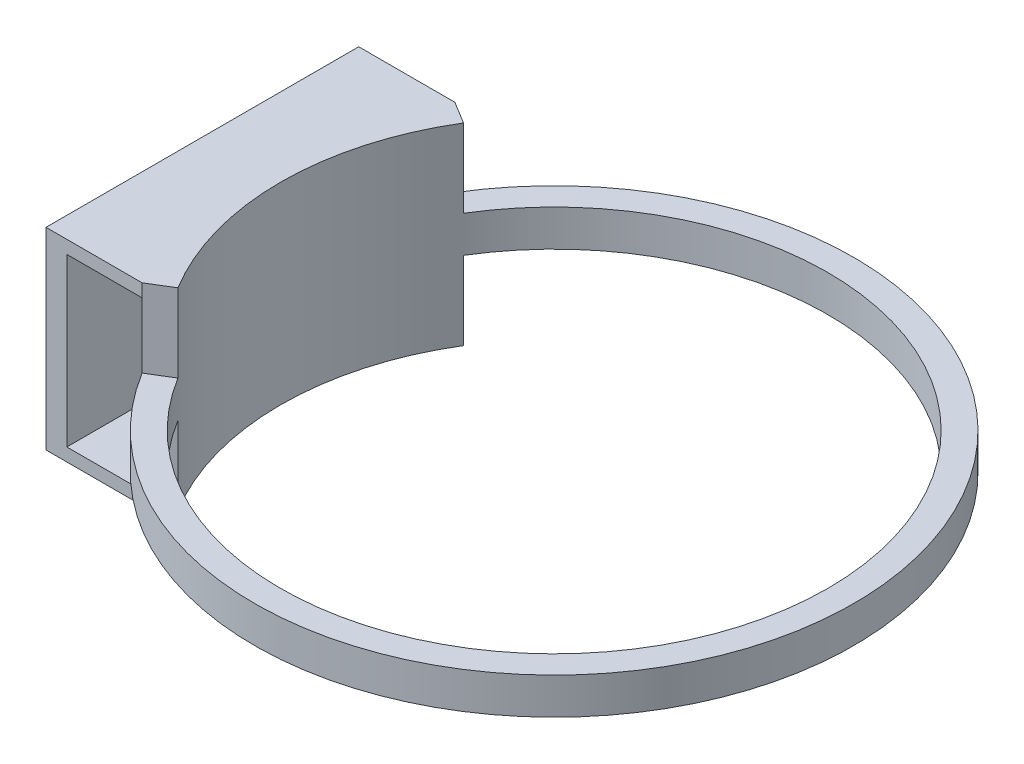
from build123d import *
from build123d.topology import SkipClean

# Parameters (mm, degrees)
EXTRUDE_1_DEPTH     = 0.5
EXTRUDE_2_DEPTH     = 6.4
EXTRUDE_3_DEPTH     = 0.5
EXTRUDE_START       = -7.4
EXTRUDE_6_DEPTH     = 7.4
SKETCH_16_W         = 0.8
SKETCH_16_H         = 12
EXTRUDE_10_DEPTH    = 6.4
EXTRUDE_11_DEPTH    = 0.5
CUT_EXTRUDE_START   = -3
CUT_EXTRUDE_1_DEPTH = 3
CUT_EXTRUDE_2_DEPTH = 3


# Read off the part's stored shape, not the designer's step: 凸台-拉伸2
with BuildPart() as part:
    # 草图1 → 凸台-拉伸1 (new body)
    with BuildSketch(Plane(origin=(0, 0, 0), x_dir=(1, 0, 0), z_dir=(0, 1, 0))):
        with BuildLine():
            Line((11.456239028, 1.002291042), (10.46004433, 0.915135299))
            ThreePointArc((10.46004433, 0.915135299), (-10.5, 0), (10.46004433, -0.915135299))
            Line((10.46004433, -0.915135299), (11.456239028, -1.002291042))
            ThreePointArc((11.456239028, -1.002291042), (5.310109052, -10.200624582), (-5.75, -9.959292144))
            ThreePointArc((-5.75, -9.959292144), (-8.028256991, -8.233898814), (-9.810708435, -6))
            Line((-9.810708435, -6), (-13.5, -6))
            Line((-13.5, -6), (-13.5, 0))
            Line((-13.5, 0), (-13.5, 6))
            Line((-13.5, 6), (-9.810708435, 6))
            ThreePointArc((-9.810708435, 6), (-8.028256991, 8.233898814), (-5.75, 9.959292144))
            ThreePointArc((-5.75, 9.959292144), (5.310109052, 10.200624582), (11.456239028, 1.002291042))
        make_face()
    extrude(amount=EXTRUDE_1_DEPTH)

    # 凸台-拉伸2 outline → 凸台-拉伸2 (add)
    with BuildSketch(Plane(origin=(0, 0.5, 0), x_dir=(1, 0, 0), z_dir=(0, 1, 0))):
        with BuildLine():
            ThreePointArc((11.456239028, 1.002291042), (-11.5, 0), (11.456239028, -1.002291042))
            Line((11.456239028, -1.002291042), (10.46004433, -0.915135299))
            ThreePointArc((10.46004433, -0.915135299), (-10.5, 0), (10.46004433, 0.915135299))
            Line((10.46004433, 0.915135299), (11.456239028, 1.002291042))
        make_face()
    extrude(amount=EXTRUDE_2_DEPTH)

    # 草图11 → 凸台-拉伸3 (add)
    with BuildSketch(Plane(origin=(0, 6.9, 0), x_dir=(1, 0, 0), z_dir=(0, 1, 0))):
        with BuildLine():
            Line((10.46004433, 0.915135299), (11.456239028, 1.002291042))
            ThreePointArc((11.456239028, 1.002291042), (-11.5, 0), (11.456239028, -1.002291042))
            Line((11.456239028, -1.002291042), (10.46004433, -0.915135299))
            ThreePointArc((10.46004433, -0.915135299), (-10.5, 0), (10.46004433, 0.915135299))
        make_face()
    extrude(amount=EXTRUDE_3_DEPTH)

    # 草图14 → 凸台-拉伸6 (add)
    with SkipClean():  # the faces are left unmerged after this step: merging them gives an invalid solid
        with BuildSketch(Plane(origin=(0, 7.4, 0), x_dir=(1, 0, 0), z_dir=(0, 1, 0)).offset(EXTRUDE_START)):
            with BuildLine():
                Line((10.46004433, 0.915135299), (11.456239028, 1.002291042))
                ThreePointArc((11.456239028, 1.002291042), (11.5, 0), (11.456239028, -1.002291042))
                Line((11.456239028, -1.002291042), (10.46004433, -0.915135299))
                ThreePointArc((10.46004433, -0.915135299), (10.5, 0), (10.46004433, 0.915135299))
            make_face()
        extrude(amount=EXTRUDE_6_DEPTH)
    add(part.part.scale(1), mode=Mode.REPLACE)  # the faces are merged on a copy

    # 草图16 → 凸台-拉伸10 (add)
    with BuildSketch(Plane(origin=(0, 0.5, 0), x_dir=(1, 0, 0), z_dir=(0, 1, 0))):
        with Locations((-13.1, 0)):
            Rectangle(SKETCH_16_W, SKETCH_16_H)
    extrude(amount=EXTRUDE_10_DEPTH)

    # 草图17 → 凸台-拉伸11 (add)
    with BuildSketch(Plane(origin=(0, 6.9, 0), x_dir=(1, 0, 0), z_dir=(0, 1, 0))):
        with BuildLine():
            Line((-13.5, 6), (-9.810708435, 6))
            ThreePointArc((-9.810708435, 6), (-11.5, 0), (-9.810708435, -6))
            Line((-9.810708435, -6), (-13.5, -6))
            Line((-13.5, -6), (-13.5, 6))
        make_face()
    extrude(amount=EXTRUDE_11_DEPTH)

    # 草图18 → 切除-拉伸1 (cut)
    with BuildSketch(Plane(origin=(0, 7.4, 0), x_dir=(1, 0, 0), z_dir=(0, 1, 0)).offset(CUT_EXTRUDE_START)):
        with BuildLine():
            Line((-9.810708435, 6), (-8.957603354, 5.47826087))
            ThreePointArc((-8.957603354, 5.47826087), (10.5, 0), (-8.957603354, -5.47826087))
            Line((-8.957603354, -5.47826087), (-9.810708435, -6))
            ThreePointArc((-9.810708435, -6), (11.5, 0), (-9.810708435, 6))
        make_face()
    extrude(amount=CUT_EXTRUDE_1_DEPTH, mode=Mode.SUBTRACT)

    # 草图19 → 切除-拉伸2 (cut)
    with BuildSketch(Plane(origin=(0, 0, 0), x_dir=(-1, 0, 0), z_dir=(0, -1, 0))):
        with BuildLine():
            Line((9.810708435, 6), (8.957603354, 5.47826087))
            ThreePointArc((8.957603354, 5.47826087), (-10.5, 0), (8.957603354, -5.47826087))
            Line((8.957603354, -5.47826087), (9.810708435, -6))
            ThreePointArc((9.810708435, -6), (-11.5, 0), (9.810708435, 6))
        make_face()
    extrude(amount=-CUT_EXTRUDE_2_DEPTH, mode=Mode.SUBTRACT)


solid = part.part
